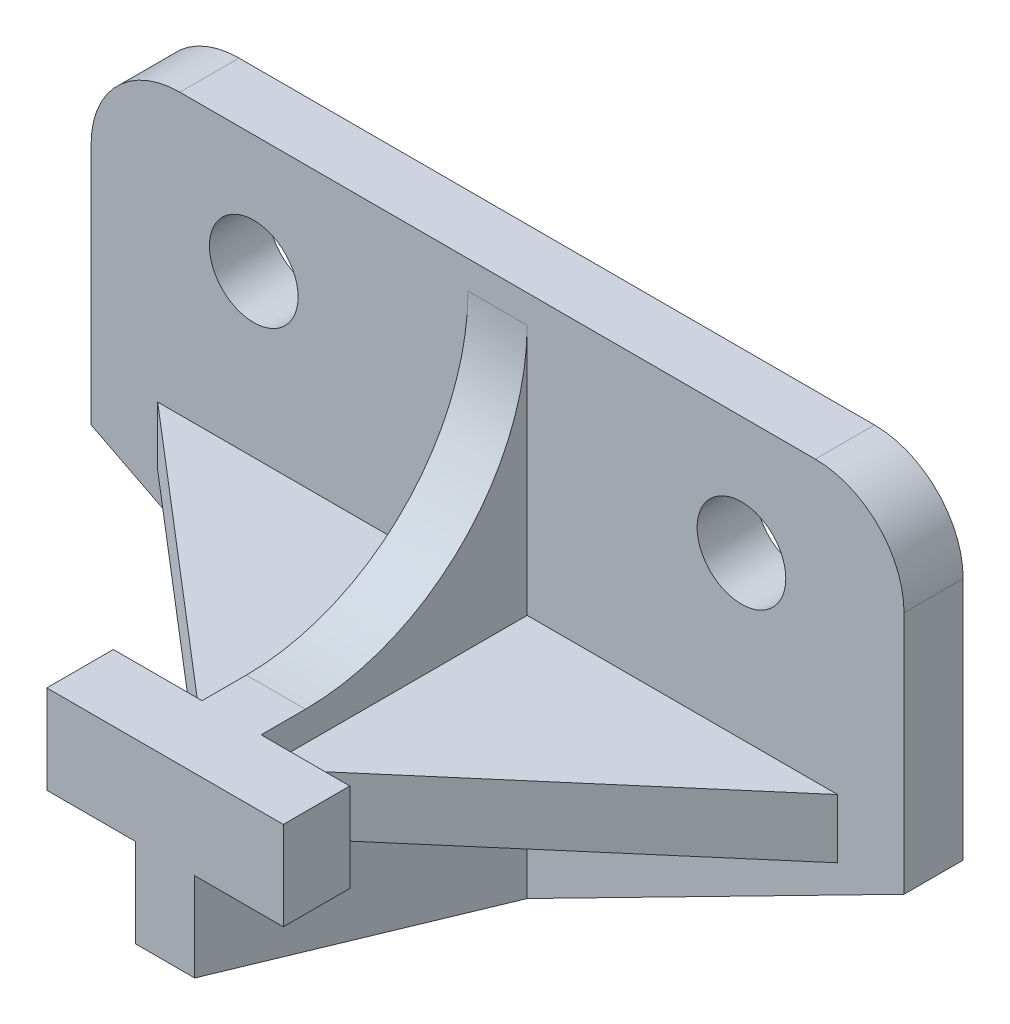
from build123d import *

# Parameters (mm, degrees)
BOSS_EXTRUDE1_DEPTH = 8
SKETCH4_W           = 32
SKETCH4_H           = 12
BOSS_EXTRUDE3_DEPTH = 9
RIB1_START          = -4
RIB1_DEPTH          = 8
FILLET1_R           = 12
SKETCH8_R           = 6
CUT_EXTRUDE1_DEPTH  = 9


# Read off the part's stored shape, not the designer's step: Rib1
with BuildPart() as part:
    # Sketch1 → Boss-Extrude1 (new body)
    with BuildSketch(Plane.XY):
        Polygon((-55, 22.5), (55, 22.5), (55, -22.5), (4, -48.5), (-4, -48.5), (-55, -22.5), align=None)
    extrude(amount=-BOSS_EXTRUDE1_DEPTH)

    # Sketch2 → Loft1 section 0
    with BuildSketch(Plane.XY):
        with BuildLine():
            Line((-46, -15.311496361), (46, -15.311496361))
            Line((46, -15.311496361), (46, -23.311496361))
            Line((46, -23.311496361), (-46, -23.311496361))
            Line((-46, -23.311496361), (-46, -15.311496361))
        make_face()
    # Sketch3 → Loft1 section 1
    with BuildSketch(Plane.XY.offset(36)):
        with BuildLine():
            Line((-4, -15.311496361), (4, -15.311496361))
            Line((4, -15.311496361), (4, -23.311496361))
            Line((4, -23.311496361), (-4, -23.311496361))
            Line((-4, -23.311496361), (-4, -15.311496361))
        make_face()
    loft()

    # Sketch4 → Boss-Extrude3 (add)
    with BuildSketch(Plane.XY.offset(36)):
        with Locations((0, -17.311496361)):
            Rectangle(SKETCH4_W, SKETCH4_H)
    extrude(amount=BOSS_EXTRUDE3_DEPTH)

    # Sketch6 → Loft3 section 0
    with BuildSketch(Plane.XY):
        with BuildLine():
            Line((-4, -23.311496361), (4, -23.311496361))
            Line((4, -23.311496361), (4, -48.5))
            Line((4, -48.5), (-4, -48.5))
            Line((-4, -48.5), (-4, -23.311496361))
        make_face()
    # Sketch5 → Loft3 section 1
    with BuildSketch(Plane.XY.offset(45)):
        with BuildLine():
            Line((-4, -35.311496361), (4, -35.311496361))
            Line((4, -35.311496361), (4, -23.311496361))
            Line((4, -23.311496361), (-4, -23.311496361))
            Line((-4, -23.311496361), (-4, -35.311496361))
        make_face()
    loft()

    # Rib1 outline → Rib1 (add)
    with BuildSketch(Plane(origin=(0, 0, 0), x_dir=(0, 0, -1), z_dir=(1, 0, 0)).offset(RIB1_START)):
        with BuildLine():
            Line((-30, -11.311496361), (-36, -11.311496361))
            Line((-36, -11.311496361), (-36, -15.311496361))
            Line((-36, -15.311496361), (0, -15.311496361))
            Line((0, -15.311496361), (0, 18.688503639))
            ThreePointArc((0, 18.688503639), (-8.786796565, -2.524699797), (-30, -11.311496361))
        make_face()
    extrude(amount=RIB1_DEPTH)

    # Fillet1
    fillet1_edges = [part.edges().sort_by_distance(p)[0] for p in [
        (-55, 22.5, -4),
        (55, 22.5, -4),
    ]]
    fillet(fillet1_edges, radius=FILLET1_R)

    # Sketch8 → Cut-Extrude1 (cut)
    with BuildSketch(Plane.XY):
        with Locations((-33, 6.5)):
            Circle(SKETCH8_R)
        with Locations((33, 6.5)):
            Circle(SKETCH8_R)
    extrude(amount=-CUT_EXTRUDE1_DEPTH, mode=Mode.SUBTRACT)


solid = part.part
